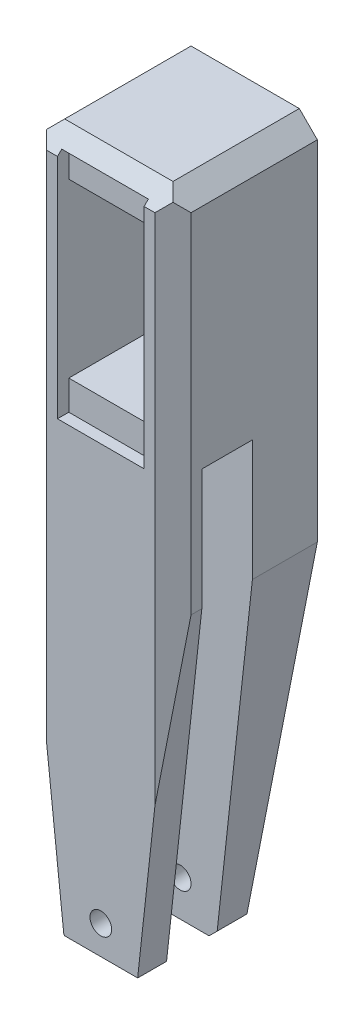
from build123d import *
from OCP.BRepFilletAPI import BRepFilletAPI_MakeChamfer

# Parameters (mm, degrees)
SKETCH1_W             = 20
SKETCH1_H             = 81.5
SKETCH1_R             = 1.5
SKETCH1_H_2           = 20
BOSS_EXTRUDE1_DEPTH   = 20
CHAMFER1_SIZE         = 2.5
SKETCH2_W             = 20
SKETCH2_H             = 7
CUT_EXTRUDE1_DEPTH    = 65
CHAMFER2_SIZE         = 2.5
CUT_EXTRUDE2_DEPTH    = 1.57
CHAMFER3_SIZE         = 2.5
SKETCH4_W             = 12
SKETCH4_H             = 23.86
CUT_EXTRUDE3_DEPTH    = 15.13
CUT_EXTRUDE4_DEPTH    = 94.547528027
SKETCH6_R             = 2.77
CUT_EXTRUDE5_DEPTH    = 95.192621792
CUT_EXTRUDE6_DEPTH    = 95.192621792
CHAMFER8_SIZE         = 1
CHAMFER8_SIZE2        = 1.129384369
CUT_EXTRUDE7_DEPTH    = 92.006867873
CHAMFER9_SIZE         = 1
CHAMFER9_SIZE2        = 1.129384369
CHAMFER9_EDGE_2_SIZE  = 1
CHAMFER9_EDGE_2_SIZE2 = 1.129384369
CHAMFER9_EDGE_3_SIZE  = 1
CHAMFER9_EDGE_3_SIZE2 = 1.129384369


with BuildPart() as part:
    # Sketch1 → Boss-Extrude1 (new body)
    # profile 1 of 2: a face of its own
    with BuildSketch(Plane.XY):
        with Locations((0, -50.75)):
            Rectangle(SKETCH1_W, SKETCH1_H)
        with Locations((0, -81.5)):
            Circle(SKETCH1_R, mode=Mode.SUBTRACT)
    # profile 2 of 2: a face of its own
    with BuildSketch(Plane.XY):
        Rectangle(SKETCH1_W, SKETCH1_H_2)
    extrude(amount=BOSS_EXTRUDE1_DEPTH)

    # Chamfer1
    chamfer1_edges = [part.edges().sort_by_distance(p)[0] for p in [
        (0, -91.5, 20),
        (-10, -91.5, 10),
        (-10, 10, 10),
        (10, 10, 10),
        (10, -91.5, 10),
        (10, -40.75, 20),
        (-10, -40.75, 20),
        (0, -91.5, 0),
    ]]
    chamfer(chamfer1_edges, length=CHAMFER1_SIZE)

    # Sketch2 → Cut-Extrude1 (cut)
    with BuildSketch(Plane.XZ.offset(91.5)):
        with Locations((0, 12.5)):
            Rectangle(SKETCH2_W, SKETCH2_H)
    extrude(amount=-CUT_EXTRUDE1_DEPTH, mode=Mode.SUBTRACT)

    # Chamfer2
    chamfer2_edges = [part.edges().sort_by_distance(p)[0] for p in [
        (10, -26.5, 12.5),
        (-10, -26.5, 12.5),
    ]]
    chamfer(chamfer2_edges, length=CHAMFER2_SIZE)

    # Sketch3 → Cut-Extrude2 (cut)
    with BuildSketch(Plane.XY.offset(20)):
        Polygon((0, -19.84), (0, -14), (0, 3.96), (0, 8.09), (-6, 8.09), (-6, -23.97), (0, -23.97), align=None)
        Polygon((0, 3.96), (0, -14), (0, -19.84), (0, -23.97), (6, -23.97), (6, 8.09), (0, 8.09), align=None)
    extrude(amount=-CUT_EXTRUDE2_DEPTH, mode=Mode.SUBTRACT)

    # Chamfer3
    # the kernel refuses this chamfer: 2.5 mm, written as the material it takes off along each edge
    with BuildSketch(Plane(origin=(13.92920747, 10, 20), x_dir=(0, -0.9996219169112968, 0.027495876610586317), z_dir=(-1, 0, 0))) as chamfer3_piece_1:
        Polygon((CHAMFER3_SIZE * 0.999621916911, -CHAMFER3_SIZE * 0.0274958766106), (-CHAMFER3_SIZE * 0.0274958766106, -CHAMFER3_SIZE * 0.999621916911), (0, 0), align=None)
    extrude(amount=27.85841494, mode=Mode.SUBTRACT)

    # Sketch4 → Cut-Extrude3 (cut)
    with BuildSketch(Plane.XY.offset(18.43)):
        with Locations((0, -7.94)):
            Rectangle(SKETCH4_W, SKETCH4_H)
    extrude(amount=-CUT_EXTRUDE3_DEPTH, mode=Mode.SUBTRACT)

    # Sketch5 → Cut-Extrude4 (cut, through all)
    with BuildSketch(Plane.XY.offset(3.3)):
        Polygon((0, -19.87), (4.5, -19.87), (4.5, -16.37), (0, -16.37), (-4.5, -16.37), (-4.5, -19.87), align=None)
    extrude(amount=-CUT_EXTRUDE4_DEPTH, mode=Mode.SUBTRACT)

    # Sketch6 → Cut-Extrude5 (cut, through all)
    with BuildSketch(Plane(origin=(0, 0, 0), x_dir=(-1, 0, 0), z_dir=(0, 0, -1))):
        Circle(SKETCH6_R)
    extrude(amount=-CUT_EXTRUDE5_DEPTH, mode=Mode.SUBTRACT)

    # Sketch7 → Cut-Extrude6 (cut, through all)
    with BuildSketch(Plane.XY.offset(20)):
        Polygon((-5, -86.5), (-7.5, -63.625), (-7.5, -89), (7.5, -89), (7.5, -63.625), (5, -86.5), align=None)
        Polygon((-7.5, -63.625), (-10, -40.75), (-10, -91.5), (10, -91.5), (10, -40.75), (7.5, -63.625), (7.5, -89), (-7.5, -89), align=None)
    extrude(amount=-CUT_EXTRUDE6_DEPTH, mode=Mode.SUBTRACT)

    # Chamfer8: one chamfer whose edges measure the first distance from different faces: ONE call of the kernel's chamfer builder (chamfer() names one face for all edges)
    chamfer8_edges_1 = [part.edges().sort_by_distance(p)[0] for p in [
        (-5, -86.5, 18),
    ]]
    chamfer8_side_1 = [part.faces().sort_by_distance(p)[0] for p in [
        (0, -86.5, 18),
    ]]
    chamfer8_edges_2 = [part.edges().sort_by_distance(p)[0] for p in [
        (0, -86.5, 20),
    ]]
    chamfer8_edges_3 = [part.edges().sort_by_distance(p)[0] for p in [
        (5, -86.5, 18),
    ]]
    chamfer8_side_3 = [part.faces().sort_by_distance(p)[0] for p in [
        (7.191358025, -66.449074074, 17.783950617),
    ]]
    chamfer8 = BRepFilletAPI_MakeChamfer(part.part.solid().wrapped)
    for e in chamfer8_edges_1:
        chamfer8.Add(CHAMFER8_SIZE, CHAMFER8_SIZE2, e.wrapped, chamfer8_side_1[0].wrapped)  # the first distance lies on this face
    for e in chamfer8_edges_2:
        chamfer8.Add(CHAMFER8_SIZE, e.wrapped)
    for e in chamfer8_edges_3:
        chamfer8.Add(CHAMFER8_SIZE, CHAMFER8_SIZE2, e.wrapped, chamfer8_side_3[0].wrapped)  # the first distance lies on this face
    add(Compound.cast(chamfer8.Shape()), mode=Mode.REPLACE)

    # Sketch8 → Cut-Extrude7 (cut, through all)
    with BuildSketch(Plane.ZY.offset(10)):
        Polygon((0, -40.75), (5, -86.5), (0, -86.5), align=None)
    extrude(amount=-CUT_EXTRUDE7_DEPTH, mode=Mode.SUBTRACT)

    # Chamfer9
    chamfer9_edges = [part.edges().sort_by_distance(p)[0] for p in [
        (-5, -86.5, 7),
    ]]
    chamfer9_side = [part.faces().sort_by_distance(p)[0] for p in [
        (0, -86.5, 7),
    ]]
    chamfer(chamfer9_edges, length=CHAMFER9_SIZE, length2=CHAMFER9_SIZE2, reference=chamfer9_side[0])

    # Chamfer9 edge 2
    chamfer9_edge_2_edges = [part.edges().sort_by_distance(p)[0] for p in [
        (5, -86.5, 7),
    ]]
    chamfer9_edge_2_side = [part.faces().sort_by_distance(p)[0] for p in [
        (0, -86.5, 7),
    ]]
    chamfer(chamfer9_edge_2_edges, length=CHAMFER9_EDGE_2_SIZE, length2=CHAMFER9_EDGE_2_SIZE2, reference=chamfer9_edge_2_side[0])

    # Chamfer9 edge 3
    chamfer9_edge_3_edges = [part.edges().sort_by_distance(p)[0] for p in [
        (0, -86.5, 5),
    ]]
    chamfer9_edge_3_side = [part.faces().sort_by_distance(p)[0] for p in [
        (0, -86.5, 7),
    ]]
    chamfer(chamfer9_edge_3_edges, length=CHAMFER9_EDGE_3_SIZE, length2=CHAMFER9_EDGE_3_SIZE2, reference=chamfer9_edge_3_side[0])


solid = part.part
